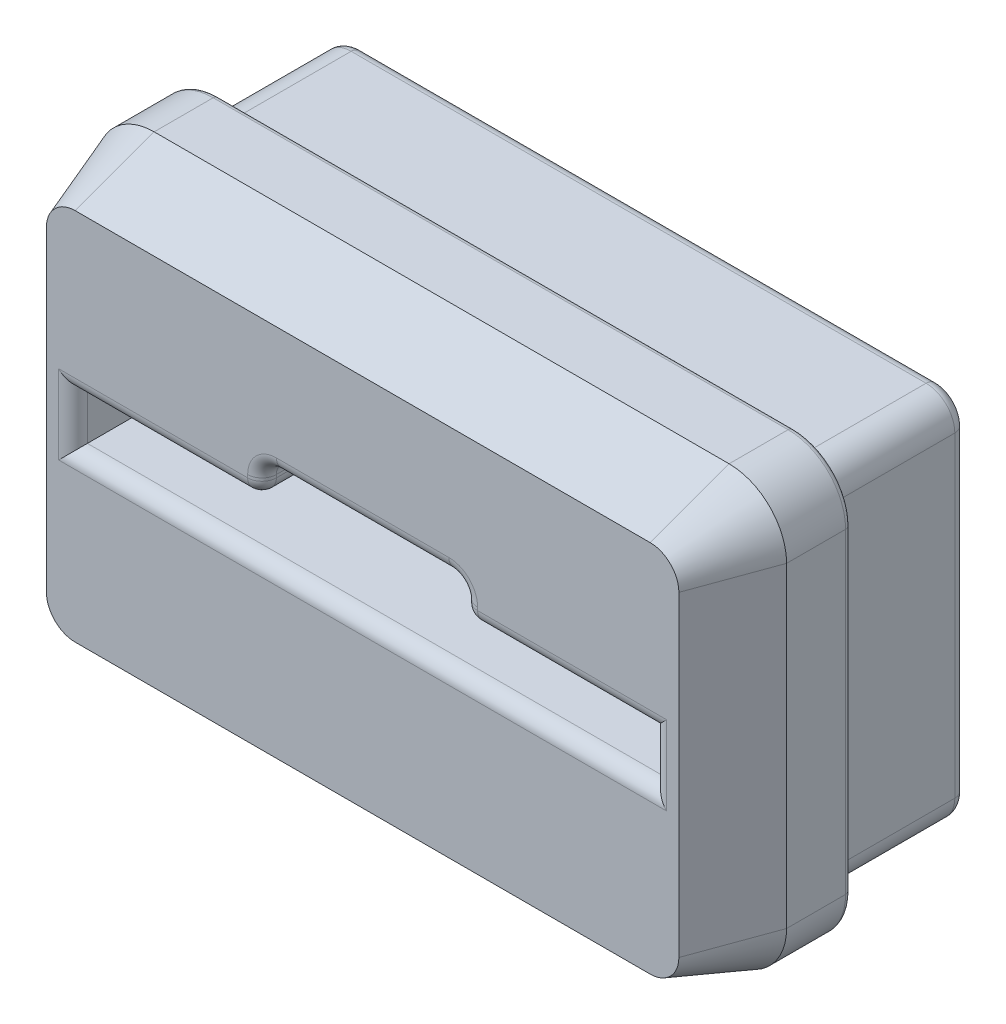
from build123d import *

# Parameters (mm, degrees)
SKETCH1_W           = 24
SKETCH1_H           = 13
BOSS_EXTRUDE1_DEPTH = 15
SKETCH2_W           = 20.15
SKETCH2_H           = 1.75
CUT_EXTRUDE1_DEPTH  = 15
FILLET1_R           = 2
CHAMFER2_SIZE       = 1
CHAMFER2_SIZE2      = 2.747477419
FILLET2_R           = 0.5
CUT_EXTRUDE4_DEPTH  = 11
SKETCH5_W           = 26.855674208
SKETCH5_H           = 19.307728506
CUT_EXTRUDE5_DEPTH  = 8
CUT_EXTRUDE6_DEPTH  = 11
SKETCH7_W           = 29.982721697
SKETCH7_H           = 21.559004648
CUT_EXTRUDE7_DEPTH  = 3
CHAMFER3_SIZE       = 2
FILLET3_R           = 0.4
FILLET4_R           = 0.2
SKETCH8_W           = 7
SKETCH8_H           = 2.2
CUT_EXTRUDE8_DEPTH  = 21.808652047
FILLET5_R           = 0.5


with BuildPart() as part:
    # Sketch1 → Boss-Extrude1 (new body)
    with BuildSketch(Plane(origin=(0, 0, 0), x_dir=(1, 0, 0), z_dir=(0, 1, 0))):
        Rectangle(SKETCH1_W, SKETCH1_H)
    extrude(amount=BOSS_EXTRUDE1_DEPTH)

    # Sketch2 → Cut-Extrude1 (cut)
    with BuildSketch(Plane.XY.offset(6.5)):
        with Locations((0, 7.575)):
            Rectangle(SKETCH2_W, SKETCH2_H)
    extrude(amount=-CUT_EXTRUDE1_DEPTH, mode=Mode.SUBTRACT)

    # Fillet1
    fillet1_edges = [part.edges().sort_by_distance(p)[0] for p in [
        (12, 15, 0),
        (12, 0, 0),
        (-12, 0, 0),
        (-12, 15, 0),
    ]]
    fillet(fillet1_edges, radius=FILLET1_R)

    # Chamfer2
    chamfer2_edges = [part.edges().sort_by_distance(p)[0] for p in [
        (0, 0, 6.5),
        (-11.414213562, 0.585786438, 6.5),
        (11.414213562, 0.585786438, 6.5),
        (-12, 7.5, 6.5),
        (12, 7.5, 6.5),
        (-11.414213562, 14.414213562, 6.5),
        (11.414213562, 14.414213562, 6.5),
        (0, 15, 6.5),
    ]]
    chamfer2_side = [part.faces().sort_by_distance(p)[0] for p in [
        (11.716980566, 7.5, 6.5),
    ]]
    chamfer(chamfer2_edges, length=CHAMFER2_SIZE, length2=CHAMFER2_SIZE2, reference=chamfer2_side[0])

    # Fillet2
    fillet2_edges = [part.edges().sort_by_distance(p)[0] for p in [
        (10.075, 7.575, 6.5),
        (0, 8.45, 6.5),
        (-10.075, 7.575, 6.5),
        (0, 6.7, 6.5),
    ]]
    fillet(fillet2_edges, radius=FILLET2_R)

    # Sketch4 → Cut-Extrude4 (cut)
    with BuildSketch(Plane(origin=(0, 0, -6.5), x_dir=(-1, 0, 0), z_dir=(0, 0, -1))):
        Polygon((-10.075, 8.45), (-8.575, 8.45), (-8.575, 11.891155889), (8.575, 11.891155889), (8.575, 8.45), (10.075, 8.45), (10.075, 6.7), (-10.075, 6.7), align=None)
    extrude(amount=-CUT_EXTRUDE4_DEPTH, mode=Mode.SUBTRACT)

    # Sketch5 → Cut-Extrude5 (cut)
    with BuildSketch(Plane(origin=(0, 0, -6.5), x_dir=(-1, 0, 0), z_dir=(0, 0, -1))):
        with Locations((-0.083402715, 7.762018115)):
            Rectangle(SKETCH5_W, SKETCH5_H)
        with BuildLine():
            Line((10, 14), (-10, 14))
            ThreePointArc((-10, 14), (-10.707106781, 13.707106781), (-11, 13))
            Line((-11, 13), (-11, 2))
            ThreePointArc((-11, 2), (-10.707106781, 1.292893219), (-10, 1))
            Line((-10, 1), (10, 1))
            ThreePointArc((10, 1), (10.707106781, 1.292893219), (11, 2))
            Line((11, 2), (11, 13))
            ThreePointArc((11, 13), (10.707106781, 13.707106781), (10, 14))
        make_face(mode=Mode.SUBTRACT)
    extrude(amount=-CUT_EXTRUDE5_DEPTH, mode=Mode.SUBTRACT)

    # Sketch6 → Cut-Extrude6 (cut)
    with BuildSketch(Plane(origin=(0, 0, -6.5), x_dir=(-1, 0, 0), z_dir=(0, 0, -1))):
        with BuildLine():
            Line((-9, 5.7), (9, 5.7))
            ThreePointArc((9, 5.7), (9.707106781, 5.407106781), (10, 4.7))
            Line((10, 4.7), (10, 3))
            ThreePointArc((10, 3), (9.707106781, 2.292893219), (9, 2))
            Line((9, 2), (-9, 2))
            ThreePointArc((-9, 2), (-9.707106781, 2.292893219), (-10, 3))
            Line((-10, 3), (-10, 4.7))
            ThreePointArc((-10, 4.7), (-9.707106781, 5.407106781), (-9, 5.7))
        make_face()
    extrude(amount=-CUT_EXTRUDE6_DEPTH, mode=Mode.SUBTRACT)

    # Sketch7 → Cut-Extrude7 (cut)
    with BuildSketch(Plane(origin=(0, 0, -6.5), x_dir=(-1, 0, 0), z_dir=(0, 0, -1))):
        with Locations((0.615824589, 7.279559508)):
            Rectangle(SKETCH7_W, SKETCH7_H)
    extrude(amount=-CUT_EXTRUDE7_DEPTH, mode=Mode.SUBTRACT)

    # Chamfer3
    chamfer3_edges = [part.edges().sort_by_distance(p)[0] for p in [
        (9.325, 8.45, -3.5),
        (-9.325, 8.45, -3.5),
    ]]
    chamfer(chamfer3_edges, length=CHAMFER3_SIZE)

    # Fillet3
    fillet3_edges = [part.edges().sort_by_distance(p)[0] for p in [
        (-9.707106781, 5.407106781, -3.5),
        (0, 5.7, -3.5),
        (9.707106781, 5.407106781, -3.5),
        (10, 3.85, -3.5),
        (9.707106781, 2.292893219, -3.5),
        (0, 2, -3.5),
        (-9.707106781, 2.292893219, -3.5),
        (10.707106781, 13.707106781, -3.5),
        (11, 7.5, -3.5),
        (10.707106781, 1.292893219, -3.5),
        (0, 1, -3.5),
        (-10.707106781, 1.292893219, -3.5),
        (-11, 7.5, -3.5),
        (-10.707106781, 13.707106781, -3.5),
        (9.325, 10.45, -3.5),
        (8.575, 11.170577944, -3.5),
        (-9.325, 10.45, -3.5),
        (-8.575, 11.170577944, -3.5),
        (0, 11.891155889, -3.5),
        (0, 6.7, -3.5),
        (-10, 3.85, -3.5),
        (0, 14, -3.5),
    ]]
    fillet(fillet3_edges, radius=FILLET3_R)

    # Fillet4
    fillet4_edges = [part.edges().sort_by_distance(p)[0] for p in [
        (0, 15, 1.5),
        (11.414213562, 14.414213562, 1.5),
        (12, 7.5, 1.5),
        (11.414213562, 0.585786438, 1.5),
        (0, 0, 1.5),
        (-11.414213562, 0.585786438, 1.5),
        (-12, 7.5, 1.5),
        (-11.414213562, 14.414213562, 1.5),
    ]]
    fillet(fillet4_edges, radius=FILLET4_R)

    # Sketch8 → Cut-Extrude8 (cut, through all)
    with BuildSketch(Plane(origin=(0, 0, 4.5), x_dir=(-1, 0, 0), z_dir=(0, 0, -1))):
        with Locations((0, 8.45)):
            Rectangle(SKETCH8_W, SKETCH8_H)
    extrude(amount=-CUT_EXTRUDE8_DEPTH, mode=Mode.SUBTRACT)

    # Fillet5
    fillet5_edges = [part.edges().sort_by_distance(p)[0] for p in [
        (3.5, 8.45, 5.25),
        (3.5, 8.596446609, 6.353553391),
        (3.5, 9.25, 6.5),
        (0, 9.55, 6.5),
        (-3.5, 9.25, 6.5),
        (-3.5, 8.45, 5.25),
        (-3.5, 8.596446609, 6.353553391),
        (-3.5, 9.55, 5.5),
        (3.5, 9.55, 5.5),
    ]]
    fillet(fillet5_edges, radius=FILLET5_R)


solid = part.part
